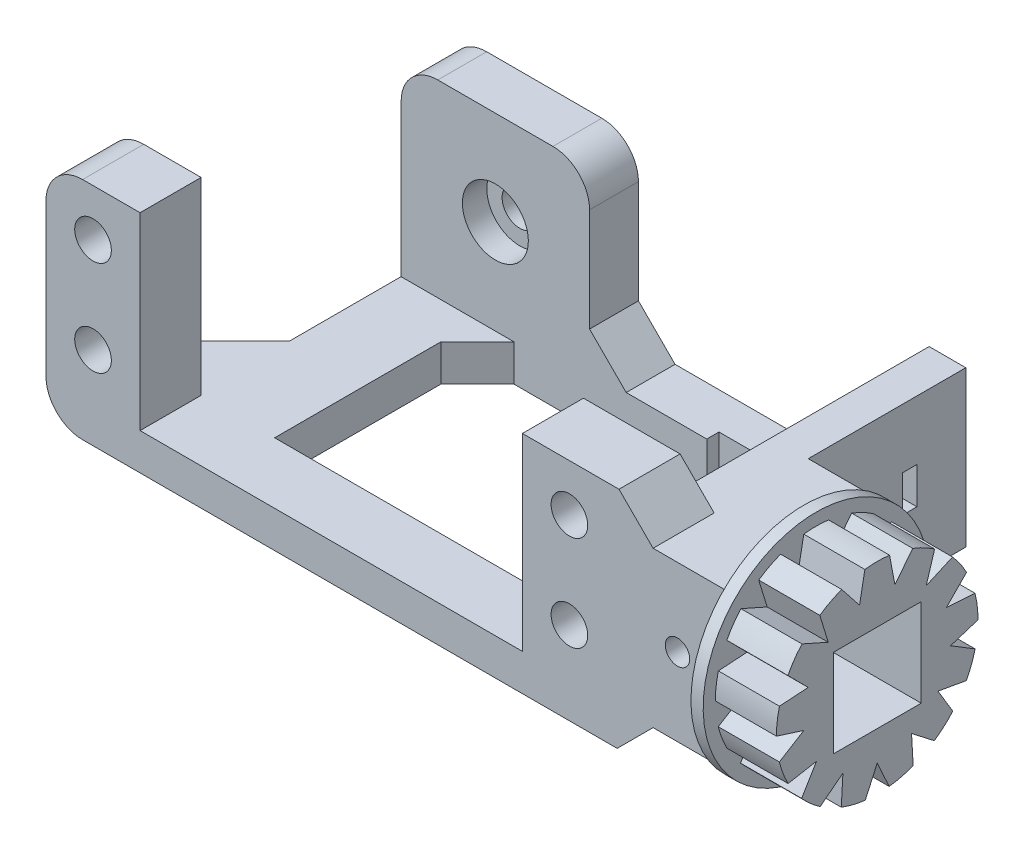
from build123d import *
from build123d.topology import SkipClean

# Parameters (mm, degrees)
SKETCH1_W                = 65.151
SKETCH1_H                = 27.178
SKETCH1_R                = 1.905
SKETCH1_W_2              = 39.751
SKETCH1_H_2              = 19.558
BOSS_EXTRUDE1_DEPTH      = 6.35
SKETCH2_W                = 39.751
SKETCH2_H                = 10.24711365
CUT_EXTRUDE1_DEPTH       = 58.77104227
SKETCH3_W                = 65.151
SKETCH3_H                = 3.81
BOSS_EXTRUDE2_DEPTH      = 27.432
CUT_EXTRUDE2_DEPTH       = 64.637138913
CUT_EXTRUDE2_DEPTH_BACK  = 64.637138913
SKETCH5_W                = 59.309
SKETCH5_H                = 23.4315
BOSS_EXTRUDE3_DEPTH      = 5.08
SKETCH6_R                = 6.35
SKETCH6_R_2              = 1.8415
BOSS_EXTRUDE4_DEPTH      = 2.54
CUT_EXTRUDE3_DEPTH       = 63.411972459
CUT_EXTRUDE3_DEPTH_BACK  = 63.411972459
SKETCH7_R                = 1.8415
SKETCH8_R                = 3.429
CUT_EXTRUDE4_DEPTH       = 2.54
SKETCH9_R                = 3.6195
SKETCH9_W                = 2.794
SKETCH9_H                = 1.524
BOSS_EXTRUDE5_DEPTH      = 3.81
CUT_EXTRUDE5_DEPTH       = 74.064442174
CUT_EXTRUDE5_DEPTH_BACK  = 74.064442174
SKETCH10_W               = 32.108263301
SKETCH10_H               = 21.082
SKETCH12_W               = 16.128600802
SKETCH12_H               = 16.1544
SKETCH12_W_2             = 9.144
SKETCH12_H_2             = 9.144
BOSS_EXTRUDE8_DEPTH      = 12.7
CHAMFER1_SIZE            = 3.81
SKETCH13_W               = 16.383399198
SKETCH13_H               = 19.8882
BOSS_EXTRUDE9_DEPTH      = 3.81
CHAMFER2_SIZE            = 3.7338
CHAMFER3_SIZE            = 3.7338
CUT_EXTRUDE7_DEPTH       = 83.650781365
CUT_EXTRUDE7_DEPTH_BACK  = 83.650781365
SKETCH14_R               = 1.27
SKETCH15_W               = 15.950556953
SKETCH15_H               = 26.00484576
SKETCH15_W_2             = 25.3365
SKETCH15_H_2             = 13.2715
CUT_EXTRUDE8_DEPTH       = 5.08
CHAMFER4_SIZE            = 9.525
FILLET1_R                = 3.81
CUT_EXTRUDE9_DEPTH       = 6.35
CHAMFER6_SIZE            = 3.81
FILLET2_R                = 3.81
CHAMFER7_SIZE            = 3.81
CUT_EXTRUDE10_DEPTH      = 71.944733816
CUT_EXTRUDE10_DEPTH_BACK = 71.944733816
SKETCH17_W               = 3.81
SKETCH17_H               = 1.27
SKETCH18_W               = 9.144
SKETCH18_H               = 9.144
BOSS_EXTRUDE10_DEPTH     = 6.35
SKETCH19_R               = 11.7475
SKETCH19_W               = 9.144
SKETCH19_H               = 9.144
BOSS_EXTRUDE11_DEPTH     = 1.27
SKETCH20_W               = 1.524
SKETCH20_H               = 3.81
CUT_EXTRUDE11_DEPTH      = 7.62


# Some blends are built 0.0001 mm under size
with BuildPart() as part:
    # Sketch1 → Boss-Extrude1 (new body)
    with BuildSketch(Plane.XY):
        with Locations((19.8755, 9.779)):
            Rectangle(SKETCH1_W, SKETCH1_H)
        with Locations((-4.8895, 14.732)):
            Circle(SKETCH1_R, mode=Mode.SUBTRACT)
        with Locations((-4.8895, 4.826)):
            Circle(SKETCH1_R, mode=Mode.SUBTRACT)
        with Locations((44.6405, 14.732)):
            Circle(SKETCH1_R, mode=Mode.SUBTRACT)
        with Locations((44.6405, 4.826)):
            Circle(SKETCH1_R, mode=Mode.SUBTRACT)
        with Locations((19.8755, 9.779)):
            Rectangle(SKETCH1_W_2, SKETCH1_H_2, mode=Mode.SUBTRACT)
    extrude(amount=BOSS_EXTRUDE1_DEPTH)

    # Sketch2 → Cut-Extrude1 (cut, through all)
    with BuildSketch(Plane.XY.offset(6.35)):
        with Locations((19.8755, 24.681556825)):
            Rectangle(SKETCH2_W, SKETCH2_H)
    extrude(amount=-CUT_EXTRUDE1_DEPTH, mode=Mode.SUBTRACT)

    # Sketch3 → Boss-Extrude2 (add)
    with BuildSketch(Plane.XY.offset(6.35)):
        with Locations((19.8755, -1.905)):
            Rectangle(SKETCH3_W, SKETCH3_H)
    extrude(amount=-BOSS_EXTRUDE2_DEPTH)

    # Sketch4 → Cut-Extrude2 (cut, two sides: drawn at the far end of the back side and taken through both)
    with BuildSketch(Plane.XY.offset(6.35).offset(-CUT_EXTRUDE2_DEPTH_BACK)):
        Polygon((-9.779, 19.6215), (49.53, 19.6215), (49.53, -10.761505665), (52.451, -10.761505665), (52.451, 19.6215), (59.186276442, 19.6215), (59.186276442, 27.845167488), (-19.143020513, 27.845167488), (-19.143020513, 19.6215), (-12.7, 19.6215), (-12.7, -7.490212521), (-9.779, -7.490212521), align=None)
    extrude(amount=CUT_EXTRUDE2_DEPTH + CUT_EXTRUDE2_DEPTH_BACK, mode=Mode.SUBTRACT)

    # Sketch5 → Boss-Extrude3 (add)
    with BuildSketch(Plane(origin=(0, 0, -21.082), x_dir=(-1, 0, 0), z_dir=(0, 0, -1))):
        with Locations((-19.8755, 7.90575)):
            Rectangle(SKETCH5_W, SKETCH5_H)
    extrude(amount=BOSS_EXTRUDE3_DEPTH)

    # Sketch6 → Boss-Extrude4 (add)
    with BuildSketch(Plane(origin=(0, 0, -26.162), x_dir=(-1, 0, 0), z_dir=(0, 0, -1))):
        with Locations(Location((-9.50976, 9.82726, 0), (0, 0, 180))):
            Circle(SKETCH6_R)
        with Locations((-9.50976, 9.82726)):
            Circle(SKETCH6_R_2, mode=Mode.SUBTRACT)
    extrude(amount=BOSS_EXTRUDE4_DEPTH)

    # Sketch7 → Cut-Extrude3 (cut, two sides: drawn at the far end of the back side and taken through both)
    with SkipClean():  # the faces are left unmerged after this step: merging them gives an invalid solid
        with BuildSketch(Plane(origin=(0, 0, -26.162), x_dir=(-1, 0, 0), z_dir=(0, 0, -1)).offset(-CUT_EXTRUDE3_DEPTH_BACK)):
            with Locations(Location((-9.50976, 9.82726, 0), (0, 0, 180))):
                Circle(SKETCH7_R)
        extrude(amount=CUT_EXTRUDE3_DEPTH + CUT_EXTRUDE3_DEPTH_BACK, mode=Mode.SUBTRACT)
    add(part.part.scale(1), mode=Mode.REPLACE)  # the faces are merged on a copy

    # Sketch8 → Cut-Extrude4 (cut)
    with BuildSketch(Plane.XY.offset(-21.082)):
        with Locations((9.50976, 9.82726)):
            Circle(SKETCH8_R)
    extrude(amount=-CUT_EXTRUDE4_DEPTH, mode=Mode.SUBTRACT)

    # Sketch9 → Boss-Extrude5 (add)
    with BuildSketch(Plane(origin=(0, 0, -26.162), x_dir=(-1, 0, 0), z_dir=(0, 0, -1))):
        with BuildLine():
            Line((-35.644817518, 19.6215), (-35.644817518, 35.2425))
            ThreePointArc((-35.644817518, 35.2425), (-29.294817518, 41.5925), (-22.944817518, 35.2425))
            Line((-22.944817518, 35.2425), (-22.944817518, 28.829))
            Line((-22.944817518, 28.829), (-22.944817518, 25.2095))
            Line((-22.944817518, 25.2095), (-22.944817518, 19.6215))
            ThreePointArc((-22.944817518, 19.6215), (-29.294817518, 13.2715), (-35.644817518, 19.6215))
        make_face()
        with Locations((-29.294817518, 28.829)):
            Circle(SKETCH9_R, mode=Mode.SUBTRACT)
        with Locations((-29.294817518, 37.0205)):
            Rectangle(SKETCH9_W, SKETCH9_H, mode=Mode.SUBTRACT)
    extrude(amount=-BOSS_EXTRUDE5_DEPTH)

    # Sketch10 → Cut-Extrude5 (cut, two sides: drawn at the far end of the back side and taken through both)
    with SkipClean():  # the faces are left unmerged after this step: merging them gives an invalid solid
        with BuildSketch(Plane.XZ.offset(3.81).offset(-CUT_EXTRUDE5_DEPTH_BACK)):
            with Locations((23.69686835, -10.541)):
                Rectangle(SKETCH10_W, SKETCH10_H)
            Polygon((-9.779, 0), (-9.779, -26.162), (-0.29464, -26.162), (-0.29464, -21.082), (-0.29464, 0), align=None)
        extrude(amount=CUT_EXTRUDE5_DEPTH + CUT_EXTRUDE5_DEPTH_BACK, mode=Mode.SUBTRACT)

    # Sketch12 → Boss-Extrude8 (add)
    with SkipClean():  # the faces are left unmerged after this step: merging them gives an invalid solid
        with BuildSketch(Plane(origin=(49.53, 0, 0), x_dir=(0, 0, -1), z_dir=(1, 0, 0))):
            with Locations((1.714300401, 8.001)):
                Rectangle(SKETCH12_W, SKETCH12_H)
            with Locations((1.714300401, 8.001)):
                Rectangle(SKETCH12_W_2, SKETCH12_H_2, mode=Mode.SUBTRACT)
        extrude(amount=BOSS_EXTRUDE8_DEPTH)

    # Chamfer1
    # the kernel refuses this chamfer: 3.81 mm, written as the material it adds along each edge
    with BuildSketch(Plane(origin=(49.53, 0, 9.798112184), x_dir=(-0.9996219169112968, -0.02749587661058634, 0), z_dir=(0, 0, -1))) as chamfer1_piece_1_section:
        Polygon((CHAMFER1_SIZE * 0.999621916911, CHAMFER1_SIZE * 0.0274958766106), (-CHAMFER1_SIZE * 0.0274958766106, CHAMFER1_SIZE * 0.999621916911), (0, 0), align=None)
    chamfer1_piece_1 = extrude(amount=19.576712986, mode=Mode.PRIVATE)
    chamfer1_piece_1 = split(chamfer1_piece_1, bisect_by=Plane(origin=(48.248454545, 3.429, -3.1431502), z_dir=(0, -1, 0)), keep=Keep.TOP, mode=Mode.PRIVATE)
    chamfer1_piece_1 = split(chamfer1_piece_1, bisect_by=Plane(origin=(48.248454545, 1.246909091, 2.857699599), z_dir=(0, 0, -1)), keep=Keep.TOP, mode=Mode.PRIVATE)
    add(chamfer1_piece_1)
    with BuildSketch(Plane(origin=(49.53, 0, 9.798112184), x_dir=(-0.9996219169112968, -0.02749587661058634, 0), z_dir=(0, 0, -1))) as chamfer1_piece_2_section:
        Polygon((CHAMFER1_SIZE * 0.999621916911, CHAMFER1_SIZE * 0.0274958766106), (-CHAMFER1_SIZE * 0.0274958766106, CHAMFER1_SIZE * 0.999621916911), (0, 0), align=None)
    chamfer1_piece_2 = extrude(amount=19.576712986, mode=Mode.PRIVATE)
    chamfer1_piece_2 = split(chamfer1_piece_2, bisect_by=Plane(origin=(49.403, 3.556, -6.286300401), z_dir=(0, 0, -1)), keep=Keep.TOP, mode=Mode.PRIVATE)
    add(chamfer1_piece_2)
    with BuildSketch(Plane(origin=(49.53, -0.0762, 6.35), x_dir=(-0.027495876610586376, -0.9996219169112968, 0), z_dir=(0, 0, -1))) as chamfer1_piece_3_section:
        Polygon((CHAMFER1_SIZE * 0.999621916911, -CHAMFER1_SIZE * 0.0274958766106), (-CHAMFER1_SIZE * 0.0274958766106, -CHAMFER1_SIZE * 0.999621916911), (0, 0), align=None)
    chamfer1_piece_3 = extrude(amount=16.128600802, mode=Mode.PRIVATE)
    chamfer1_piece_3 = split(chamfer1_piece_3, bisect_by=Plane(origin=(50.800498039, -3.81, -1.714300401), z_dir=(0, 1, 0)), keep=Keep.TOP, mode=Mode.PRIVATE)
    add(chamfer1_piece_3)
    with BuildSketch(Plane(origin=(49.53, 16.0782, 0), x_dir=(-0.027495876610586386, 0.9996219169112968, 0), z_dir=(0, 0, 1))) as chamfer1_piece_4_section:
        Polygon((CHAMFER1_SIZE * 0.999621916911, -CHAMFER1_SIZE * 0.0274958766106), (-CHAMFER1_SIZE * 0.0274958766106, -CHAMFER1_SIZE * 0.999621916911), (0, 0), align=None)
    chamfer1_piece_4 = extrude(amount=6.35, mode=Mode.PRIVATE)
    chamfer1_piece_4 = split(chamfer1_piece_4, bisect_by=Plane(origin=(50.805815888, 19.6215, 3.175), z_dir=(0, -1, 0)), keep=Keep.TOP, mode=Mode.PRIVATE)
    add(chamfer1_piece_4)

    # Sketch13 → Boss-Extrude9 (add)
    with BuildSketch(Plane(origin=(49.53, 0, 0), x_dir=(0, 0, -1), z_dir=(1, 0, 0))):
        with Locations((17.970300401, 6.1341)):
            Rectangle(SKETCH13_W, SKETCH13_H)
    extrude(amount=BOSS_EXTRUDE9_DEPTH)

    # Chamfer2
    chamfer2_edges = [part.edges().sort_by_distance(p)[0] for p in [
        (53.34, -3.81, -17.970300401),
    ]]
    chamfer(chamfer2_edges, length=CHAMFER2_SIZE - 0.0001)  # a hair under: the kernel refuses the full size

    # Chamfer3
    # the kernel refuses this chamfer: 3.7338 mm, written as the material it adds along each edge
    with BuildSketch(Plane(origin=(49.53, 16.0782, -21.082), x_dir=(0.9996219169112968, -0.027495876610586435, 0), z_dir=(0, 0, -1))) as chamfer3_piece_1_section:
        Polygon((CHAMFER3_SIZE * 0.999621916911, -CHAMFER3_SIZE * 0.0274958766106), (-CHAMFER3_SIZE * 0.0274958766106, -CHAMFER3_SIZE * 0.999621916911), (0, 0), align=None)
    chamfer3_piece_1 = extrude(amount=5.08, mode=Mode.PRIVATE)
    chamfer3_piece_1 = split(chamfer3_piece_1, bisect_by=Plane(origin=(50.777682524, 19.6215, -23.622), z_dir=(0, -1, 0)), keep=Keep.TOP, mode=Mode.PRIVATE)
    add(chamfer3_piece_1)

    # Sketch14 → Cut-Extrude7 (cut, two sides: drawn at the far end of the back side and taken through both)
    with BuildSketch(Plane.XY.offset(6.35).offset(-CUT_EXTRUDE7_DEPTH_BACK)):
        with Locations(Location((55.88, 8.001, 0), (0, 0, 180))):
            Circle(SKETCH14_R)
    extrude(amount=CUT_EXTRUDE7_DEPTH + CUT_EXTRUDE7_DEPTH_BACK, mode=Mode.SUBTRACT)

    # Sketch15 → Cut-Extrude8 (cut)
    with BuildSketch(Plane(origin=(0, 0, -26.162), x_dir=(-1, 0, 0), z_dir=(0, 0, -1))):
        with Locations((8.259758477, 6.61907712)):
            Rectangle(SKETCH15_W, SKETCH15_H)
        with Locations((-31.97225, 7.90575)):
            Rectangle(SKETCH15_W_2, SKETCH15_H_2)
    extrude(amount=-CUT_EXTRUDE8_DEPTH, mode=Mode.SUBTRACT)

    # Chamfer4
    # the kernel refuses this chamfer: 9.525 mm, written as the material it adds along each edge
    with BuildSketch(Plane(origin=(-0.29464, -3.81, 0), x_dir=(-0.9996219169112966, 0, 0.027495876610586358), z_dir=(0, 1, 0))) as chamfer4_piece_1_section:
        Polygon((CHAMFER4_SIZE * 0.999621916911, -CHAMFER4_SIZE * 0.0274958766106), (-CHAMFER4_SIZE * 0.0274958766106, -CHAMFER4_SIZE * 0.999621916911), (0, 0), align=None)
    chamfer4_piece_1 = extrude(amount=3.81, mode=Mode.PRIVATE)
    chamfer4_piece_1 = split(chamfer4_piece_1, bisect_by=Plane(origin=(-9.779, -1.905, -3.148349728), z_dir=(1, 0, 0)), keep=Keep.TOP, mode=Mode.PRIVATE)
    add(chamfer4_piece_1)

    # Fillet1
    fillet1_edges = [part.edges().sort_by_distance(p)[0] for p in [
        (-9.779, -3.81, 3.15468),
        (-9.779, 19.6215, 3.175),
        (-0.28448, 19.6215, -23.622),
    ]]
    fillet(fillet1_edges, radius=FILLET1_R - 0.0001)  # a hair under: the kernel refuses the full size

    # Sketch16 → Cut-Extrude9 (cut)
    with BuildSketch(Plane(origin=(0, 0, -26.162), x_dir=(-1, 0, 0), z_dir=(0, 0, -1))):
        Polygon((-49.53, 1.27), (-19.304, 1.27), (-19.304, 48.700808031), (-49.53, 48.700808031), (-49.53, 22.932024955), (-53.34, 22.932024955), (-53.34, 16.0782), (-49.53, 16.0782), align=None)
    extrude(amount=-CUT_EXTRUDE9_DEPTH, mode=Mode.SUBTRACT)

    # Chamfer6
    chamfer6_edges = [part.edges().sort_by_distance(p)[0] for p in [
        (49.53, 0, -15.430300401),
        (7.642736699, -1.905, -21.082),
    ]]
    chamfer(chamfer6_edges, length=CHAMFER6_SIZE)

    # Fillet2
    fillet2_edges = [part.edges().sort_by_distance(p)[0] for p in [
        (19.304, 19.6215, -23.622),
    ]]
    fillet(fillet2_edges, radius=FILLET2_R)

    # Chamfer7
    chamfer7_edges = [part.edges().sort_by_distance(p)[0] for p in [
        (19.304, 1.27, -23.622),
    ]]
    chamfer(chamfer7_edges, length=CHAMFER7_SIZE)

    # Sketch17 → Cut-Extrude10 (cut, two sides: drawn at the far end of the back side and taken through both)
    with BuildSketch(Plane(origin=(0, 1.27, 0), x_dir=(1, 0, 0), z_dir=(0, 1, 0)).offset(-CUT_EXTRUDE10_DEPTH_BACK)):
        with Locations((33.395261943, 21.717)):
            Rectangle(SKETCH17_W, SKETCH17_H)
    extrude(amount=CUT_EXTRUDE10_DEPTH + CUT_EXTRUDE10_DEPTH_BACK, mode=Mode.SUBTRACT)

    # Sketch18 → Boss-Extrude10 (add)
    with BuildSketch(Plane(origin=(62.23, 0, 0), x_dir=(0, 0, -1), z_dir=(1, 0, 0))):
        with BuildLine():
            Line((2.998048785, 18.399557416), (3.552275043, 15.457956254))
            Line((3.552275043, 15.457956254), (5.410048246, 17.805052943))
            ThreePointArc((5.410048246, 17.805052943), (6.583437436, 17.278365509), (7.68345373, 16.611877701))
            Line((7.68345373, 16.611877701), (6.807166487, 13.749657442))
            Line((6.807166487, 13.749657442), (9.542893183, 14.964558093))
            ThreePointArc((9.542893183, 14.964558093), (10.337113856, 13.952898384), (11.001397584, 12.851549677))
            Line((11.001397584, 12.851549677), (8.895343686, 10.724410489))
            Line((8.895343686, 10.724410489), (11.882301857, 10.528796003))
            ThreePointArc((11.882301857, 10.528796003), (12.115407629, 9.263923067), (12.191779394, 7.980019178))
            Line((12.191779394, 7.980019178), (9.33843041, 7.075263014))
            Line((9.33843041, 7.075263014), (11.892343936, 5.513946312))
            ThreePointArc((11.892343936, 5.513946312), (11.510933084, 4.285627296), (10.981897035, 3.113295132))
            Line((10.981897035, 3.113295132), (8.034920829, 3.638190726))
            Line((8.034920829, 3.638190726), (9.5707189, 1.068850649))
            ThreePointArc((9.5707189, 1.068850649), (8.662168053, 0.158478636), (7.648919973, -0.633714632))
            Line((7.648919973, -0.633714632), (5.28343328, 1.200585465))
            Line((5.28343328, 1.200585465), (5.449283066, -1.788173139))
            ThreePointArc((5.449283066, -1.788173139), (4.221730274, -2.172042892), (2.956393088, -2.402615333))
            Line((2.956393088, -2.402615333), (1.714300401, 0.32087322))
            Line((1.714300401, 0.32087322), (0.472207714, -2.402615333))
            ThreePointArc((0.472207714, -2.402615333), (-0.793129472, -2.172042892), (-2.020682264, -1.788173139))
            Line((-2.020682264, -1.788173139), (-1.854832478, 1.200585465))
            Line((-1.854832478, 1.200585465), (-4.220319172, -0.633714632))
            ThreePointArc((-4.220319172, -0.633714632), (-5.233567251, 0.158478636), (-6.142118098, 1.068850649))
            Line((-6.142118098, 1.068850649), (-4.606320027, 3.638190726))
            Line((-4.606320027, 3.638190726), (-7.553296233, 3.113295132))
            ThreePointArc((-7.553296233, 3.113295132), (-8.082332282, 4.285627296), (-8.463743134, 5.513946312))
            Line((-8.463743134, 5.513946312), (-5.909829608, 7.075263014))
            Line((-5.909829608, 7.075263014), (-8.763178592, 7.980019178))
            ThreePointArc((-8.763178592, 7.980019178), (-8.686806827, 9.263923067), (-8.453701055, 10.528796003))
            Line((-8.453701055, 10.528796003), (-5.466742884, 10.724410489))
            Line((-5.466742884, 10.724410489), (-7.572796782, 12.851549677))
            ThreePointArc((-7.572796782, 12.851549677), (-6.908513054, 13.952898384), (-6.114292381, 14.964558093))
            Line((-6.114292381, 14.964558093), (-3.378565685, 13.749657442))
            Line((-3.378565685, 13.749657442), (-4.254852928, 16.611877701))
            ThreePointArc((-4.254852928, 16.611877701), (-3.154836634, 17.278365509), (-1.981447444, 17.805052943))
            Line((-1.981447444, 17.805052943), (-0.123674241, 15.457956254))
            Line((-0.123674241, 15.457956254), (0.430552017, 18.399557416))
            ThreePointArc((0.430552017, 18.399557416), (1.714300401, 18.4785), (2.998048785, 18.399557416))
        make_face()
        with Locations((1.714300401, 8.001)):
            Rectangle(SKETCH18_W, SKETCH18_H, mode=Mode.SUBTRACT)
    extrude(amount=BOSS_EXTRUDE10_DEPTH)

    # Sketch19 → Boss-Extrude11 (add)
    with BuildSketch(Plane.ZY.offset(-62.23)):
        with Locations(Location((-1.714300401, 8.001, 0), (0, 0, 270))):
            Circle(SKETCH19_R)
        with Locations((-1.714300401, 8.001)):
            Rectangle(SKETCH19_W, SKETCH19_H, mode=Mode.SUBTRACT)
    extrude(amount=BOSS_EXTRUDE11_DEPTH)

    # Sketch20 → Cut-Extrude11 (cut)
    with BuildSketch(Plane(origin=(53.34, 0, 0), x_dir=(0, 0, -1), z_dir=(1, 0, 0))):
        with Locations((20.32, 8.001)):
            Rectangle(SKETCH20_W, SKETCH20_H)
    extrude(amount=-CUT_EXTRUDE11_DEPTH, mode=Mode.SUBTRACT)


solid = part.part
